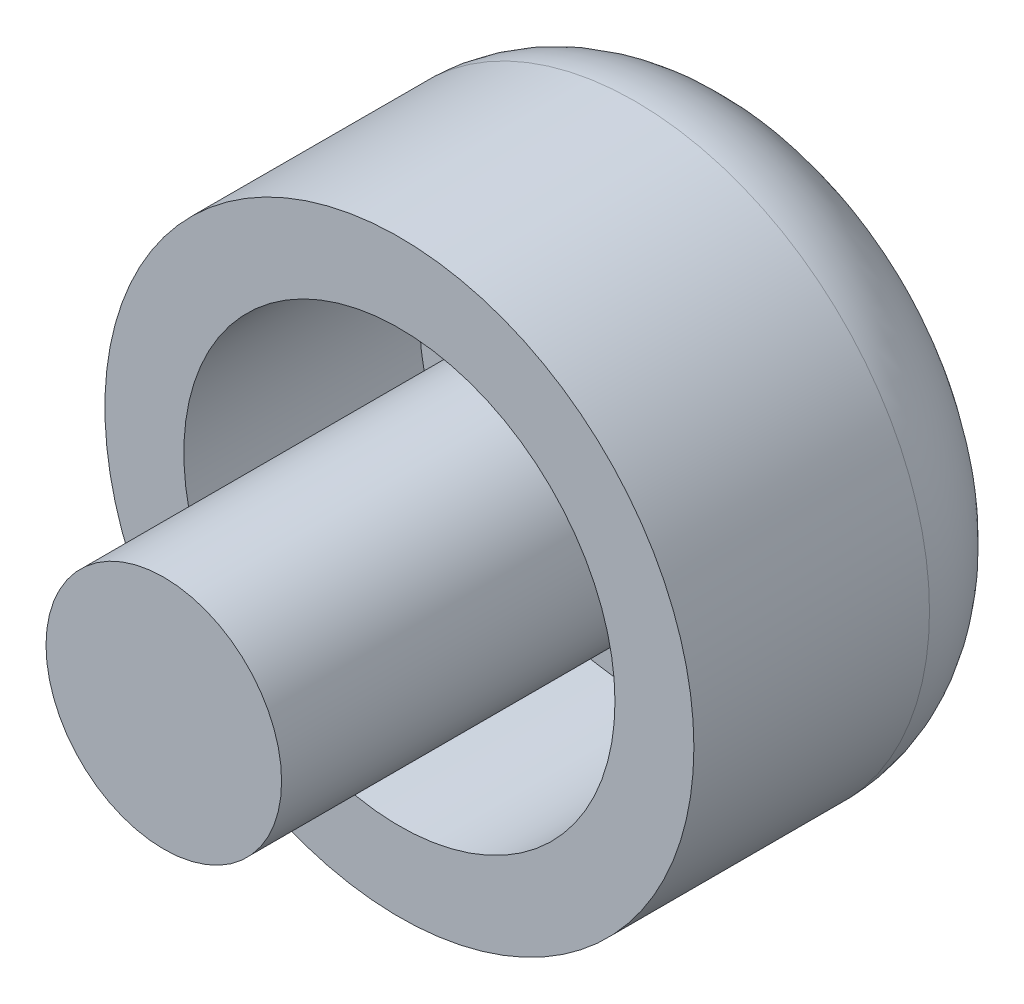
from build123d import *

# Parameters (mm, degrees)
SKETCH_1_R      = 5
EXTRUDE_1_DEPTH = 20
SKETCH_2_R      = 12.5
EXTRUDE_2_DEPTH = 5
EXTRUDE_START   = 10
SKETCH_3_R      = 12.5
SKETCH_3_R_2    = 9.15
EXTRUDE_3_DEPTH = 10
FILLET_1_R      = 5


with BuildPart() as part:
    # 草图1 → 凸台-拉伸1 (new body)
    with BuildSketch(Plane.XY):
        Circle(SKETCH_1_R)
    extrude(amount=EXTRUDE_1_DEPTH)

    # 草图2 → 凸台-拉伸2 (add)
    with BuildSketch(Plane(origin=(0, 0, 0), x_dir=(-1, 0, 0), z_dir=(0, 0, -1))):
        Circle(SKETCH_2_R)
    extrude(amount=EXTRUDE_2_DEPTH)

    # 草图3 → 凸台-拉伸3 (add)
    with BuildSketch(Plane.XY.offset(EXTRUDE_START)):
        Circle(SKETCH_3_R)
        Circle(SKETCH_3_R_2, mode=Mode.SUBTRACT)
    extrude(amount=-EXTRUDE_3_DEPTH)

    # 圆角1
    fillet_1_edges = [part.edges().sort_by_distance(p)[0] for p in [
        (12.5, 0, -5),
    ]]
    fillet(fillet_1_edges, radius=FILLET_1_R - 0.0001)  # a hair under: the kernel refuses the full size


solid = part.part
